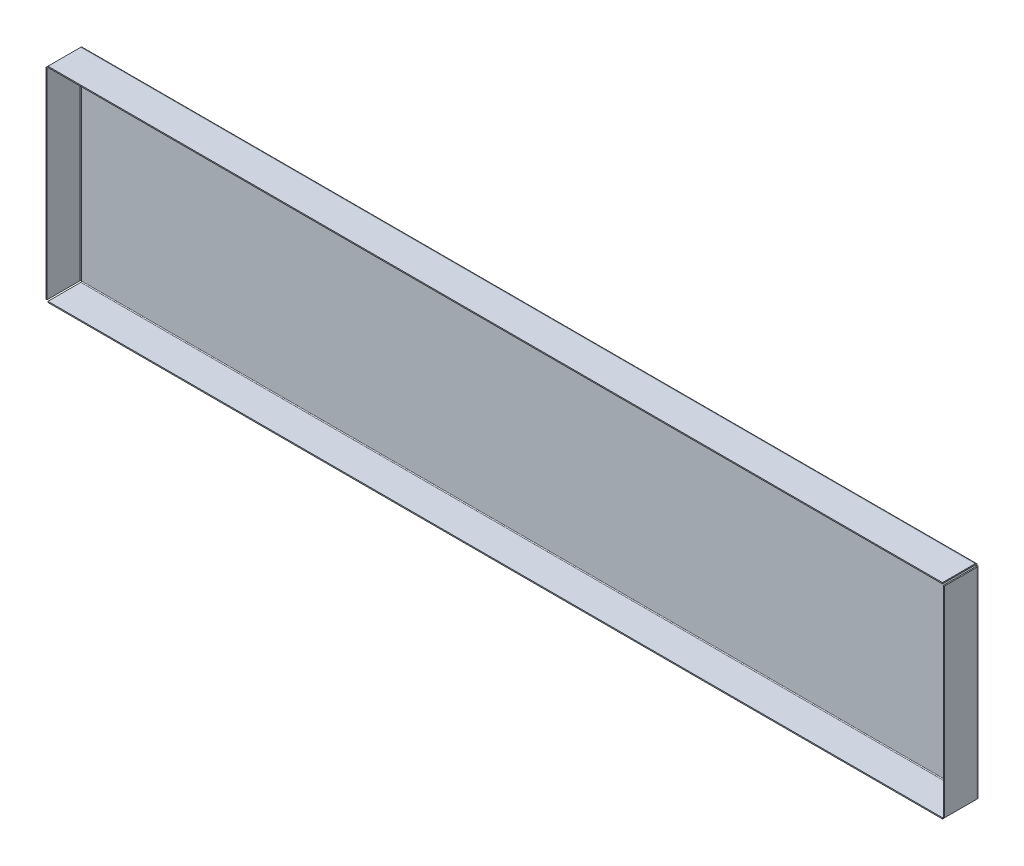
from build123d import *

# Parameters (mm, degrees)
BASE_FLANGE1_DEPTH         = 1
SKETCHED_START             = 31
SKETCHED_BEND1_DEPTH       = 178
SKETCHED_BEND1_2_DEPTH     = 793
SKETCHED_BEND1_3_OUTLINE_W = 793
SKETCHED_BEND1_3_OUTLINE_H = 1
SKETCHED_BEND1_3_DEPTH     = 29.234623369
SKETCHED_START_2           = 210.765376631
SKETCHED_BEND1_4_OUTLINE_W = 793
SKETCHED_BEND1_4_OUTLINE_H = 1
SKETCHED_BEND1_4_DEPTH     = 29.234623369
SKETCHED_BEND1_5_DEPTH     = 178
SKETCHED_BEND1_6_DEPTH     = 793
SKETCHED_BEND1_7_OUTLINE_W = 178
SKETCHED_BEND1_7_OUTLINE_H = 1
SKETCHED_BEND1_7_DEPTH     = 29.234623369
SKETCHED_START_3           = 825.765376631
SKETCHED_BEND1_8_OUTLINE_W = 178
SKETCHED_BEND1_8_OUTLINE_H = 1
SKETCHED_BEND1_8_DEPTH     = 29.234623369


# Read off the part's stored shape, not the designer's step: Sketched Bend1
# Sheet-metal steps are written as plain solids
with BuildPart() as part:
    # Sketch1 → Base-Flange1 (new body)
    with BuildSketch(Plane.XY):
        Polygon((0, 209), (31, 209), (31, 240), (824, 240), (824, 209), (855, 209), (855, 31), (824, 31), (824, 0), (31, 0), (31, 31), (0, 31), align=None)
    extrude(amount=-BASE_FLANGE1_DEPTH)

    # Sketched Bend1 outline → Sketched Bend1 (add)
    with BuildSketch(Plane(origin=(0, 0, 0), x_dir=(1, 0, 0), z_dir=(0, 1, 0)).offset(SKETCHED_START)):
        with BuildLine():
            Line((29.234623369, -0.7366), (29.234623369, -29.765376631))
            Line((29.234623369, -29.765376631), (30.234623369, -29.765376631))
            Line((30.234623369, -29.765376631), (30.234623369, -0.7366))
            ThreePointArc((30.234623369, -0.7366), (30.450368514, -0.215745145), (30.971223369, 0))
            Line((30.971223369, 0), (29.398582279, 0))
            ThreePointArc((29.398582279, 0), (29.276108612, -0.359286442), (29.234623369, -0.7366))
        make_face()
        with BuildLine():
            Line((825.601417721, 0), (824.028776631, 0))
            ThreePointArc((824.028776631, 0), (824.549631486, -0.215745145), (824.765376631, -0.7366))
            Line((824.765376631, -0.7366), (824.765376631, -29.765376631))
            Line((824.765376631, -29.765376631), (825.765376631, -29.765376631))
            Line((825.765376631, -29.765376631), (825.765376631, -0.7366))
            ThreePointArc((825.765376631, -0.7366), (825.723891388, -0.359286442), (825.601417721, 0))
        make_face()
    extrude(amount=SKETCHED_BEND1_DEPTH)

    # Sketched Bend1 2 outline → Sketched Bend1 2 (add)
    with BuildSketch(Plane.YZ.offset(SKETCHED_START)):
        with BuildLine():
            Line((209.028776631, 0), (210.601417721, 0))
            ThreePointArc((210.601417721, 0), (210.723891388, 0.359286442), (210.765376631, 0.7366))
            Line((210.765376631, 0.7366), (210.765376631, 29.765376631))
            Line((210.765376631, 29.765376631), (209.765376631, 29.765376631))
            Line((209.765376631, 29.765376631), (209.765376631, 0.7366))
            ThreePointArc((209.765376631, 0.7366), (209.549631486, 0.215745145), (209.028776631, 0))
        make_face()
        with BuildLine():
            ThreePointArc((29.234623369, 0.7366), (29.276108612, 0.359286442), (29.398582279, 0))
            Line((29.398582279, 0), (30.971223369, 0))
            ThreePointArc((30.971223369, 0), (30.450368514, 0.215745145), (30.234623369, 0.7366))
            Line((30.234623369, 0.7366), (30.234623369, 29.765376631))
            Line((30.234623369, 29.765376631), (29.234623369, 29.765376631))
            Line((29.234623369, 29.765376631), (29.234623369, 0.7366))
        make_face()
    extrude(amount=SKETCHED_BEND1_2_DEPTH)

    # Sketched Bend1 3 outline → Sketched Bend1 3 (cut)
    with BuildSketch(Plane(origin=(0, 0, 0), x_dir=(1, 0, 0), z_dir=(0, 1, 0))):
        with Locations((427.5, 0.5)):
            Rectangle(SKETCHED_BEND1_3_OUTLINE_W, SKETCHED_BEND1_3_OUTLINE_H)
    extrude(amount=SKETCHED_BEND1_3_DEPTH, mode=Mode.SUBTRACT)

    # Sketched Bend1 4 outline → Sketched Bend1 4 (cut)
    with BuildSketch(Plane(origin=(0, 0, 0), x_dir=(1, 0, 0), z_dir=(0, 1, 0)).offset(SKETCHED_START_2)):
        with Locations((427.5, 0.5)):
            Rectangle(SKETCHED_BEND1_4_OUTLINE_W, SKETCHED_BEND1_4_OUTLINE_H)
    extrude(amount=SKETCHED_BEND1_4_DEPTH, mode=Mode.SUBTRACT)

    # Sketched Bend1 5 outline → Sketched Bend1 5 (cut)
    with BuildSketch(Plane(origin=(0, 0, 0), x_dir=(1, 0, 0), z_dir=(0, 1, 0)).offset(SKETCHED_START)):
        with BuildLine():
            Line((0, 0), (29.398582279, 0))
            ThreePointArc((29.398582279, 0), (30.039397205, 0.728828115), (30.971223369, 1))
            Line((30.971223369, 1), (0, 1))
            Line((0, 1), (0, 0))
        make_face()
        with BuildLine():
            Line((855, 1), (824.028776631, 1))
            ThreePointArc((824.028776631, 1), (824.960602795, 0.728828115), (825.601417721, 0))
            Line((825.601417721, 0), (855, 0))
            Line((855, 0), (855, 1))
        make_face()
    extrude(amount=SKETCHED_BEND1_5_DEPTH, mode=Mode.SUBTRACT)

    # Sketched Bend1 6 outline → Sketched Bend1 6 (cut)
    with BuildSketch(Plane.YZ.offset(SKETCHED_START)):
        with BuildLine():
            ThreePointArc((210.601417721, 0), (209.960602795, -0.728828115), (209.028776631, -1))
            Line((209.028776631, -1), (240, -1))
            Line((240, -1), (240, 0))
            Line((240, 0), (210.601417721, 0))
        make_face()
        with BuildLine():
            Line((0, -1), (30.971223369, -1))
            ThreePointArc((30.971223369, -1), (30.039397205, -0.728828115), (29.398582279, 0))
            Line((29.398582279, 0), (0, 0))
            Line((0, 0), (0, -1))
        make_face()
    extrude(amount=SKETCHED_BEND1_6_DEPTH, mode=Mode.SUBTRACT)

    # Sketched Bend1 7 outline → Sketched Bend1 7 (cut)
    with BuildSketch(Plane.YZ):
        with Locations((120, -0.5)):
            Rectangle(SKETCHED_BEND1_7_OUTLINE_W, SKETCHED_BEND1_7_OUTLINE_H)
    extrude(amount=SKETCHED_BEND1_7_DEPTH, mode=Mode.SUBTRACT)

    # Sketched Bend1 8 outline → Sketched Bend1 8 (cut)
    with BuildSketch(Plane.YZ.offset(SKETCHED_START_3)):
        with Locations((120, -0.5)):
            Rectangle(SKETCHED_BEND1_8_OUTLINE_W, SKETCHED_BEND1_8_OUTLINE_H)
    extrude(amount=SKETCHED_BEND1_8_DEPTH, mode=Mode.SUBTRACT)


solid = part.part
